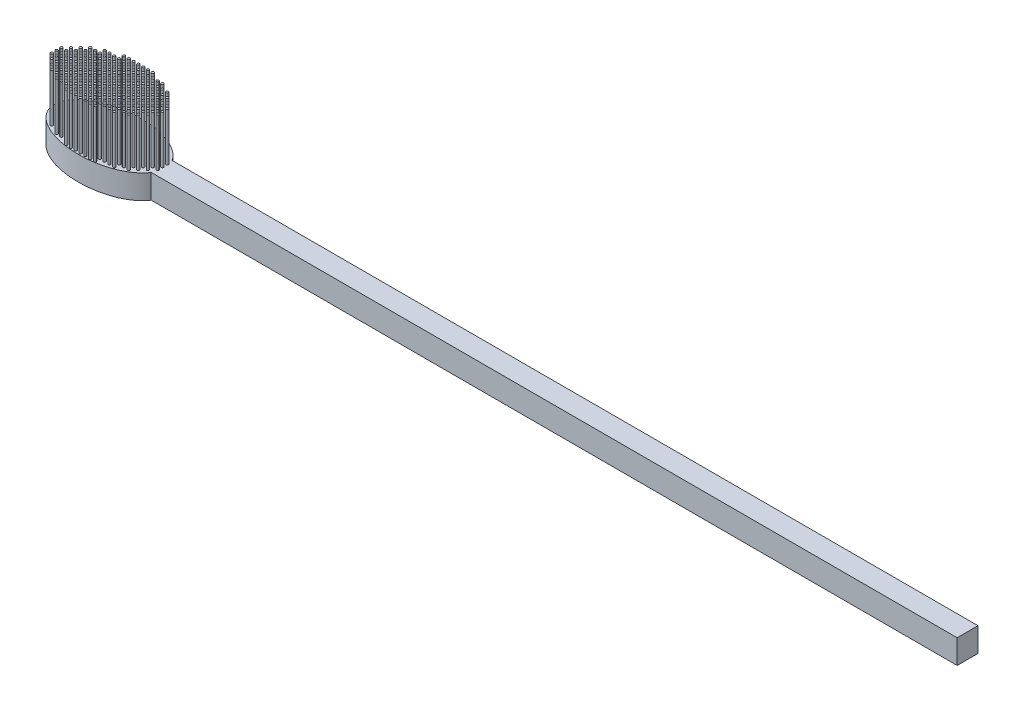
from build123d import *

# Parameters (mm, degrees)
BOSS_EXTRUDE1_DEPTH       = 5
SKETCH3_R                 = 0.25
BOSS_EXTRUDE2_DEPTH       = 10
LPATTERN1_COUNT           = 12
LPATTERN1_PITCH           = 1
LPATTERN1_COUNT_DIR2      = 7
LPATTERN1_PITCH_DIR2      = 1
MIRROR1_COPY_1_SKETCH_R   = 0.25
MIRROR1_COPY_1_DEPTH      = 10
MIRROR1_COPY_2_SKETCH_R   = 0.25
MIRROR1_COPY_2_DEPTH      = 10
MIRROR1_COPY_3_SKETCH_R   = 0.25
MIRROR1_COPY_3_DEPTH      = 10
MIRROR1_COPY_4_SKETCH_R   = 0.25
MIRROR1_COPY_4_DEPTH      = 10
MIRROR1_COPY_5_SKETCH_R   = 0.25
MIRROR1_COPY_5_DEPTH      = 10
MIRROR1_COPY_6_SKETCH_R   = 0.25
MIRROR1_COPY_6_DEPTH      = 10
MIRROR1_COPY_7_SKETCH_R   = 0.25
MIRROR1_COPY_7_DEPTH      = 10
MIRROR1_COPY_8_SKETCH_R   = 0.25
MIRROR1_COPY_8_DEPTH      = 10
MIRROR1_COPY_9_SKETCH_R   = 0.25
MIRROR1_COPY_9_DEPTH      = 10
MIRROR1_COPY_10_SKETCH_R  = 0.25
MIRROR1_COPY_10_DEPTH     = 10
MIRROR1_COPY_11_SKETCH_R  = 0.25
MIRROR1_COPY_11_DEPTH     = 10
MIRROR1_COPY_12_SKETCH_R  = 0.25
MIRROR1_COPY_12_DEPTH     = 10
MIRROR1_COPY_13_SKETCH_R  = 0.25
MIRROR1_COPY_13_DEPTH     = 10
MIRROR1_COPY_14_SKETCH_R  = 0.25
MIRROR1_COPY_14_DEPTH     = 10
MIRROR1_COPY_15_SKETCH_R  = 0.25
MIRROR1_COPY_15_DEPTH     = 10
MIRROR1_COPY_16_SKETCH_R  = 0.25
MIRROR1_COPY_16_DEPTH     = 10
MIRROR1_COPY_17_SKETCH_R  = 0.25
MIRROR1_COPY_17_DEPTH     = 10
MIRROR1_COPY_18_SKETCH_R  = 0.25
MIRROR1_COPY_18_DEPTH     = 10
MIRROR1_COPY_19_SKETCH_R  = 0.25
MIRROR1_COPY_19_DEPTH     = 10
MIRROR1_COPY_20_SKETCH_R  = 0.25
MIRROR1_COPY_20_DEPTH     = 10
MIRROR1_COPY_21_SKETCH_R  = 0.25
MIRROR1_COPY_21_DEPTH     = 10
MIRROR1_COPY_22_SKETCH_R  = 0.25
MIRROR1_COPY_22_DEPTH     = 10
MIRROR1_COPY_23_SKETCH_R  = 0.25
MIRROR1_COPY_23_DEPTH     = 10
MIRROR1_COPY_24_SKETCH_R  = 0.25
MIRROR1_COPY_24_DEPTH     = 10
MIRROR1_COPY_25_SKETCH_R  = 0.25
MIRROR1_COPY_25_DEPTH     = 10
MIRROR1_COPY_26_SKETCH_R  = 0.25
MIRROR1_COPY_26_DEPTH     = 10
MIRROR1_COPY_27_SKETCH_R  = 0.25
MIRROR1_COPY_27_DEPTH     = 10
MIRROR1_COPY_28_SKETCH_R  = 0.25
MIRROR1_COPY_28_DEPTH     = 10
MIRROR1_COPY_29_SKETCH_R  = 0.25
MIRROR1_COPY_29_DEPTH     = 10
MIRROR1_COPY_30_SKETCH_R  = 0.25
MIRROR1_COPY_30_DEPTH     = 10
MIRROR1_COPY_31_SKETCH_R  = 0.25
MIRROR1_COPY_31_DEPTH     = 10
MIRROR1_COPY_32_SKETCH_R  = 0.25
MIRROR1_COPY_32_DEPTH     = 10
MIRROR1_COPY_33_SKETCH_R  = 0.25
MIRROR1_COPY_33_DEPTH     = 10
MIRROR1_COPY_34_SKETCH_R  = 0.25
MIRROR1_COPY_34_DEPTH     = 10
MIRROR1_COPY_35_SKETCH_R  = 0.25
MIRROR1_COPY_35_DEPTH     = 10
MIRROR1_COPY_36_SKETCH_R  = 0.25
MIRROR1_COPY_36_DEPTH     = 10
MIRROR1_COPY_37_SKETCH_R  = 0.25
MIRROR1_COPY_37_DEPTH     = 10
MIRROR1_COPY_38_SKETCH_R  = 0.25
MIRROR1_COPY_38_DEPTH     = 10
MIRROR1_COPY_39_SKETCH_R  = 0.25
MIRROR1_COPY_39_DEPTH     = 10
MIRROR1_COPY_40_SKETCH_R  = 0.25
MIRROR1_COPY_40_DEPTH     = 10
MIRROR1_COPY_41_SKETCH_R  = 0.25
MIRROR1_COPY_41_DEPTH     = 10
MIRROR1_COPY_42_SKETCH_R  = 0.25
MIRROR1_COPY_42_DEPTH     = 10
MIRROR1_COPY_43_SKETCH_R  = 0.25
MIRROR1_COPY_43_DEPTH     = 10
MIRROR1_COPY_44_SKETCH_R  = 0.25
MIRROR1_COPY_44_DEPTH     = 10
MIRROR1_COPY_45_SKETCH_R  = 0.25
MIRROR1_COPY_45_DEPTH     = 10
MIRROR1_COPY_46_SKETCH_R  = 0.25
MIRROR1_COPY_46_DEPTH     = 10
MIRROR1_COPY_47_SKETCH_R  = 0.25
MIRROR1_COPY_47_DEPTH     = 10
MIRROR1_COPY_48_SKETCH_R  = 0.25
MIRROR1_COPY_48_DEPTH     = 10
MIRROR1_COPY_49_SKETCH_R  = 0.25
MIRROR1_COPY_49_DEPTH     = 10
MIRROR1_COPY_50_SKETCH_R  = 0.25
MIRROR1_COPY_50_DEPTH     = 10
MIRROR1_COPY_51_SKETCH_R  = 0.25
MIRROR1_COPY_51_DEPTH     = 10
MIRROR1_COPY_52_SKETCH_R  = 0.25
MIRROR1_COPY_52_DEPTH     = 10
MIRROR1_COPY_53_SKETCH_R  = 0.25
MIRROR1_COPY_53_DEPTH     = 10
MIRROR1_COPY_54_SKETCH_R  = 0.25
MIRROR1_COPY_54_DEPTH     = 10
MIRROR1_COPY_55_SKETCH_R  = 0.25
MIRROR1_COPY_55_DEPTH     = 10
MIRROR1_COPY_56_SKETCH_R  = 0.25
MIRROR1_COPY_56_DEPTH     = 10
MIRROR1_COPY_57_SKETCH_R  = 0.25
MIRROR1_COPY_57_DEPTH     = 10
MIRROR1_COPY_58_SKETCH_R  = 0.25
MIRROR1_COPY_58_DEPTH     = 10
MIRROR1_COPY_59_SKETCH_R  = 0.25
MIRROR1_COPY_59_DEPTH     = 10
MIRROR1_COPY_60_SKETCH_R  = 0.25
MIRROR1_COPY_60_DEPTH     = 10
MIRROR1_COPY_61_SKETCH_R  = 0.25
MIRROR1_COPY_61_DEPTH     = 10
MIRROR1_COPY_62_SKETCH_R  = 0.25
MIRROR1_COPY_62_DEPTH     = 10
MIRROR1_COPY_63_SKETCH_R  = 0.25
MIRROR1_COPY_63_DEPTH     = 10
MIRROR1_COPY_64_SKETCH_R  = 0.25
MIRROR1_COPY_64_DEPTH     = 10
MIRROR1_COPY_65_SKETCH_R  = 0.25
MIRROR1_COPY_65_DEPTH     = 10
MIRROR2_COPY_1_SKETCH_R   = 0.25
MIRROR2_COPY_1_DEPTH      = 10
MIRROR2_COPY_2_SKETCH_R   = 0.25
MIRROR2_COPY_2_DEPTH      = 10
MIRROR2_COPY_3_SKETCH_R   = 0.25
MIRROR2_COPY_3_DEPTH      = 10
MIRROR2_COPY_4_SKETCH_R   = 0.25
MIRROR2_COPY_4_DEPTH      = 10
MIRROR2_COPY_5_SKETCH_R   = 0.25
MIRROR2_COPY_5_DEPTH      = 10
MIRROR2_COPY_6_SKETCH_R   = 0.25
MIRROR2_COPY_6_DEPTH      = 10
MIRROR2_COPY_7_SKETCH_R   = 0.25
MIRROR2_COPY_7_DEPTH      = 10
MIRROR2_COPY_8_SKETCH_R   = 0.25
MIRROR2_COPY_8_DEPTH      = 10
MIRROR2_COPY_9_SKETCH_R   = 0.25
MIRROR2_COPY_9_DEPTH      = 10
MIRROR2_COPY_10_SKETCH_R  = 0.25
MIRROR2_COPY_10_DEPTH     = 10
MIRROR2_COPY_11_SKETCH_R  = 0.25
MIRROR2_COPY_11_DEPTH     = 10
MIRROR2_COPY_12_SKETCH_R  = 0.25
MIRROR2_COPY_12_DEPTH     = 10
MIRROR2_COPY_13_SKETCH_R  = 0.25
MIRROR2_COPY_13_DEPTH     = 10
MIRROR2_COPY_14_SKETCH_R  = 0.25
MIRROR2_COPY_14_DEPTH     = 10
MIRROR2_COPY_15_SKETCH_R  = 0.25
MIRROR2_COPY_15_DEPTH     = 10
MIRROR2_COPY_16_SKETCH_R  = 0.25
MIRROR2_COPY_16_DEPTH     = 10
MIRROR2_COPY_17_SKETCH_R  = 0.25
MIRROR2_COPY_17_DEPTH     = 10
MIRROR2_COPY_18_SKETCH_R  = 0.25
MIRROR2_COPY_18_DEPTH     = 10
MIRROR2_COPY_19_SKETCH_R  = 0.25
MIRROR2_COPY_19_DEPTH     = 10
MIRROR2_COPY_20_SKETCH_R  = 0.25
MIRROR2_COPY_20_DEPTH     = 10
MIRROR2_COPY_21_SKETCH_R  = 0.25
MIRROR2_COPY_21_DEPTH     = 10
MIRROR2_COPY_22_SKETCH_R  = 0.25
MIRROR2_COPY_22_DEPTH     = 10
MIRROR2_COPY_23_SKETCH_R  = 0.25
MIRROR2_COPY_23_DEPTH     = 10
MIRROR2_COPY_24_SKETCH_R  = 0.25
MIRROR2_COPY_24_DEPTH     = 10
MIRROR2_COPY_25_SKETCH_R  = 0.25
MIRROR2_COPY_25_DEPTH     = 10
MIRROR2_COPY_26_SKETCH_R  = 0.25
MIRROR2_COPY_26_DEPTH     = 10
MIRROR2_COPY_27_SKETCH_R  = 0.25
MIRROR2_COPY_27_DEPTH     = 10
MIRROR2_COPY_28_SKETCH_R  = 0.25
MIRROR2_COPY_28_DEPTH     = 10
MIRROR2_COPY_29_SKETCH_R  = 0.25
MIRROR2_COPY_29_DEPTH     = 10
MIRROR2_COPY_30_SKETCH_R  = 0.25
MIRROR2_COPY_30_DEPTH     = 10
MIRROR2_COPY_31_SKETCH_R  = 0.25
MIRROR2_COPY_31_DEPTH     = 10
MIRROR2_COPY_32_SKETCH_R  = 0.25
MIRROR2_COPY_32_DEPTH     = 10
MIRROR2_COPY_33_SKETCH_R  = 0.25
MIRROR2_COPY_33_DEPTH     = 10
MIRROR2_COPY_34_SKETCH_R  = 0.25
MIRROR2_COPY_34_DEPTH     = 10
MIRROR2_COPY_35_SKETCH_R  = 0.25
MIRROR2_COPY_35_DEPTH     = 10
MIRROR2_COPY_36_SKETCH_R  = 0.25
MIRROR2_COPY_36_DEPTH     = 10
MIRROR2_COPY_37_SKETCH_R  = 0.25
MIRROR2_COPY_37_DEPTH     = 10
MIRROR2_COPY_38_SKETCH_R  = 0.25
MIRROR2_COPY_38_DEPTH     = 10
MIRROR2_COPY_39_SKETCH_R  = 0.25
MIRROR2_COPY_39_DEPTH     = 10
MIRROR2_COPY_40_SKETCH_R  = 0.25
MIRROR2_COPY_40_DEPTH     = 10
MIRROR2_COPY_41_SKETCH_R  = 0.25
MIRROR2_COPY_41_DEPTH     = 10
MIRROR2_COPY_42_SKETCH_R  = 0.25
MIRROR2_COPY_42_DEPTH     = 10
MIRROR2_COPY_43_SKETCH_R  = 0.25
MIRROR2_COPY_43_DEPTH     = 10
MIRROR2_COPY_44_SKETCH_R  = 0.25
MIRROR2_COPY_44_DEPTH     = 10
MIRROR2_COPY_45_SKETCH_R  = 0.25
MIRROR2_COPY_45_DEPTH     = 10
MIRROR2_COPY_46_SKETCH_R  = 0.25
MIRROR2_COPY_46_DEPTH     = 10
MIRROR2_COPY_47_SKETCH_R  = 0.25
MIRROR2_COPY_47_DEPTH     = 10
MIRROR2_COPY_48_SKETCH_R  = 0.25
MIRROR2_COPY_48_DEPTH     = 10
MIRROR2_COPY_49_SKETCH_R  = 0.25
MIRROR2_COPY_49_DEPTH     = 10
MIRROR2_COPY_50_SKETCH_R  = 0.25
MIRROR2_COPY_50_DEPTH     = 10
MIRROR2_COPY_51_SKETCH_R  = 0.25
MIRROR2_COPY_51_DEPTH     = 10
MIRROR2_COPY_52_SKETCH_R  = 0.25
MIRROR2_COPY_52_DEPTH     = 10
MIRROR2_COPY_53_SKETCH_R  = 0.25
MIRROR2_COPY_53_DEPTH     = 10
MIRROR2_COPY_54_SKETCH_R  = 0.25
MIRROR2_COPY_54_DEPTH     = 10
MIRROR2_COPY_55_SKETCH_R  = 0.25
MIRROR2_COPY_55_DEPTH     = 10
MIRROR2_COPY_56_SKETCH_R  = 0.25
MIRROR2_COPY_56_DEPTH     = 10
MIRROR2_COPY_57_SKETCH_R  = 0.25
MIRROR2_COPY_57_DEPTH     = 10
MIRROR2_COPY_58_SKETCH_R  = 0.25
MIRROR2_COPY_58_DEPTH     = 10
MIRROR2_COPY_59_SKETCH_R  = 0.25
MIRROR2_COPY_59_DEPTH     = 10
MIRROR2_COPY_60_SKETCH_R  = 0.25
MIRROR2_COPY_60_DEPTH     = 10
MIRROR2_COPY_61_SKETCH_R  = 0.25
MIRROR2_COPY_61_DEPTH     = 10
MIRROR2_COPY_62_SKETCH_R  = 0.25
MIRROR2_COPY_62_DEPTH     = 10
MIRROR2_COPY_63_SKETCH_R  = 0.25
MIRROR2_COPY_63_DEPTH     = 10
MIRROR2_COPY_64_SKETCH_R  = 0.25
MIRROR2_COPY_64_DEPTH     = 10
MIRROR2_COPY_65_SKETCH_R  = 0.25
MIRROR2_COPY_65_DEPTH     = 10
MIRROR2_COPY_66_SKETCH_R  = 0.25
MIRROR2_COPY_66_DEPTH     = 10
MIRROR2_COPY_67_SKETCH_R  = 0.25
MIRROR2_COPY_67_DEPTH     = 10
MIRROR2_COPY_68_SKETCH_R  = 0.25
MIRROR2_COPY_68_DEPTH     = 10
MIRROR2_COPY_69_SKETCH_R  = 0.25
MIRROR2_COPY_69_DEPTH     = 10
MIRROR2_COPY_70_SKETCH_R  = 0.25
MIRROR2_COPY_70_DEPTH     = 10
MIRROR2_COPY_71_SKETCH_R  = 0.25
MIRROR2_COPY_71_DEPTH     = 10
MIRROR2_COPY_72_SKETCH_R  = 0.25
MIRROR2_COPY_72_DEPTH     = 10
MIRROR2_COPY_73_SKETCH_R  = 0.25
MIRROR2_COPY_73_DEPTH     = 10
MIRROR2_COPY_74_SKETCH_R  = 0.25
MIRROR2_COPY_74_DEPTH     = 10
MIRROR2_COPY_75_SKETCH_R  = 0.25
MIRROR2_COPY_75_DEPTH     = 10
MIRROR2_COPY_76_SKETCH_R  = 0.25
MIRROR2_COPY_76_DEPTH     = 10
MIRROR2_COPY_77_SKETCH_R  = 0.25
MIRROR2_COPY_77_DEPTH     = 10
MIRROR2_COPY_78_SKETCH_R  = 0.25
MIRROR2_COPY_78_DEPTH     = 10
MIRROR2_COPY_79_SKETCH_R  = 0.25
MIRROR2_COPY_79_DEPTH     = 10
MIRROR2_COPY_80_SKETCH_R  = 0.25
MIRROR2_COPY_80_DEPTH     = 10
MIRROR2_COPY_81_SKETCH_R  = 0.25
MIRROR2_COPY_81_DEPTH     = 10
MIRROR2_COPY_82_SKETCH_R  = 0.25
MIRROR2_COPY_82_DEPTH     = 10
MIRROR2_COPY_83_SKETCH_R  = 0.25
MIRROR2_COPY_83_DEPTH     = 10
MIRROR2_COPY_84_SKETCH_R  = 0.25
MIRROR2_COPY_84_DEPTH     = 10
MIRROR2_COPY_85_SKETCH_R  = 0.25
MIRROR2_COPY_85_DEPTH     = 10
MIRROR2_COPY_86_SKETCH_R  = 0.25
MIRROR2_COPY_86_DEPTH     = 10
MIRROR2_COPY_87_SKETCH_R  = 0.25
MIRROR2_COPY_87_DEPTH     = 10
MIRROR2_COPY_88_SKETCH_R  = 0.25
MIRROR2_COPY_88_DEPTH     = 10
MIRROR2_COPY_89_SKETCH_R  = 0.25
MIRROR2_COPY_89_DEPTH     = 10
MIRROR2_COPY_90_SKETCH_R  = 0.25
MIRROR2_COPY_90_DEPTH     = 10
MIRROR2_COPY_91_SKETCH_R  = 0.25
MIRROR2_COPY_91_DEPTH     = 10
MIRROR2_COPY_92_SKETCH_R  = 0.25
MIRROR2_COPY_92_DEPTH     = 10
MIRROR2_COPY_93_SKETCH_R  = 0.25
MIRROR2_COPY_93_DEPTH     = 10
MIRROR2_COPY_94_SKETCH_R  = 0.25
MIRROR2_COPY_94_DEPTH     = 10
MIRROR2_COPY_95_SKETCH_R  = 0.25
MIRROR2_COPY_95_DEPTH     = 10
MIRROR2_COPY_96_SKETCH_R  = 0.25
MIRROR2_COPY_96_DEPTH     = 10
MIRROR2_COPY_97_SKETCH_R  = 0.25
MIRROR2_COPY_97_DEPTH     = 10
MIRROR2_COPY_98_SKETCH_R  = 0.25
MIRROR2_COPY_98_DEPTH     = 10
MIRROR2_COPY_99_SKETCH_R  = 0.25
MIRROR2_COPY_99_DEPTH     = 10
MIRROR2_COPY_100_SKETCH_R = 0.25
MIRROR2_COPY_100_DEPTH    = 10
MIRROR2_COPY_101_SKETCH_R = 0.25
MIRROR2_COPY_101_DEPTH    = 10
MIRROR2_COPY_102_SKETCH_R = 0.25
MIRROR2_COPY_102_DEPTH    = 10
MIRROR2_COPY_103_SKETCH_R = 0.25
MIRROR2_COPY_103_DEPTH    = 10
MIRROR2_COPY_104_SKETCH_R = 0.25
MIRROR2_COPY_104_DEPTH    = 10
MIRROR2_COPY_105_SKETCH_R = 0.25
MIRROR2_COPY_105_DEPTH    = 10
MIRROR2_COPY_106_SKETCH_R = 0.25
MIRROR2_COPY_106_DEPTH    = 10
MIRROR2_COPY_107_SKETCH_R = 0.25
MIRROR2_COPY_107_DEPTH    = 10
MIRROR2_COPY_108_SKETCH_R = 0.25
MIRROR2_COPY_108_DEPTH    = 10
MIRROR2_COPY_109_SKETCH_R = 0.25
MIRROR2_COPY_109_DEPTH    = 10
MIRROR2_COPY_110_SKETCH_R = 0.25
MIRROR2_COPY_110_DEPTH    = 10
MIRROR2_COPY_111_SKETCH_R = 0.25
MIRROR2_COPY_111_DEPTH    = 10
MIRROR2_COPY_112_SKETCH_R = 0.25
MIRROR2_COPY_112_DEPTH    = 10
MIRROR2_COPY_113_SKETCH_R = 0.25
MIRROR2_COPY_113_DEPTH    = 10
MIRROR2_COPY_114_SKETCH_R = 0.25
MIRROR2_COPY_114_DEPTH    = 10
MIRROR2_COPY_115_SKETCH_R = 0.25
MIRROR2_COPY_115_DEPTH    = 10
MIRROR2_COPY_116_SKETCH_R = 0.25
MIRROR2_COPY_116_DEPTH    = 10
MIRROR2_COPY_117_SKETCH_R = 0.25
MIRROR2_COPY_117_DEPTH    = 10
MIRROR2_COPY_118_SKETCH_R = 0.25
MIRROR2_COPY_118_DEPTH    = 10
MIRROR2_COPY_119_SKETCH_R = 0.25
MIRROR2_COPY_119_DEPTH    = 10
MIRROR2_COPY_120_SKETCH_R = 0.25
MIRROR2_COPY_120_DEPTH    = 10
MIRROR2_COPY_121_SKETCH_R = 0.25
MIRROR2_COPY_121_DEPTH    = 10
MIRROR2_COPY_122_SKETCH_R = 0.25
MIRROR2_COPY_122_DEPTH    = 10
MIRROR2_COPY_123_SKETCH_R = 0.25
MIRROR2_COPY_123_DEPTH    = 10
MIRROR2_COPY_124_SKETCH_R = 0.25
MIRROR2_COPY_124_DEPTH    = 10
MIRROR2_COPY_125_SKETCH_R = 0.25
MIRROR2_COPY_125_DEPTH    = 10
MIRROR2_COPY_126_SKETCH_R = 0.25
MIRROR2_COPY_126_DEPTH    = 10
MIRROR2_COPY_127_SKETCH_R = 0.25
MIRROR2_COPY_127_DEPTH    = 10
MIRROR2_COPY_128_SKETCH_R = 0.25
MIRROR2_COPY_128_DEPTH    = 10
MIRROR2_COPY_129_SKETCH_R = 0.25
MIRROR2_COPY_129_DEPTH    = 10
MIRROR2_COPY_130_SKETCH_R = 0.25
MIRROR2_COPY_130_DEPTH    = 10
MIRROR2_COPY_131_SKETCH_R = 0.25
MIRROR2_COPY_131_DEPTH    = 10


with BuildPart() as part:
    # Sketch1 → Boss-Extrude1 (new body)
    with BuildSketch(Plane(origin=(0, 0, 0), x_dir=(1, 0, 0), z_dir=(0, 1, 0))):
        with BuildLine():
            Line((10.842303978, -2.166666667), (178.5, -2.166666667))
            Line((178.5, -2.166666667), (178.5, 2.166666667))
            Line((178.5, 2.166666667), (10.842303978, 2.166666667))
            add(Edge.make_bspline(
                [(10.842303978, 2.166666667), (5.660036883, 10.451433739), (-6.838914155, 5.225716869), (-19.337865193, 0), (-6.838914155, -5.225716869), (5.660036883, -10.451433739), (10.842303978, -2.166666667)],
                knots=[0.339836909, 0.339836909, 0.339836909, 2.207674072, 2.207674072, 4.075511235, 4.075511235, 5.943348398, 5.943348398, 5.943348398], degree=2, weights=[1, 0.594688187, 1, 0.594688187, 1, 0.594688187, 1]))
        make_face()
    extrude(amount=-BOSS_EXTRUDE1_DEPTH)

    # Sketch3 → Boss-Extrude2 (add)
    with BuildSketch(Plane(origin=(0, 0, 0), x_dir=(1, 0, 0), z_dir=(0, 1, 0))):
        Circle(SKETCH3_R)
    boss_extrude2 = extrude(amount=BOSS_EXTRUDE2_DEPTH)

    # LPattern1: Boss-Extrude2 12 × 7, 19 skipped
    with Locations(*[(i * LPATTERN1_PITCH, 0, j * LPATTERN1_PITCH_DIR2) for i in range(LPATTERN1_COUNT) for j in range(LPATTERN1_COUNT_DIR2) if (i, j) not in ((0, 0), (4, 6), (5, 6), (6, 6), (7, 5), (7, 6), (8, 5), (8, 6), (9, 4), (9, 5), (9, 6), (10, 3), (10, 4), (10, 5), (10, 6), (11, 2), (11, 3), (11, 4), (11, 5), (11, 6))]):
        add(boss_extrude2)

    # Mirror1 copy 1 sketch → Mirror1 copy 1 (add)
    with BuildSketch(Plane(origin=(0, 0, -1), x_dir=(1, 0, 0), z_dir=(0, 1, 0))):
        Circle(MIRROR1_COPY_1_SKETCH_R)
    extrude(amount=MIRROR1_COPY_1_DEPTH)

    # Mirror1 copy 2 sketch → Mirror1 copy 2 (add)
    with BuildSketch(Plane(origin=(0, 0, -2), x_dir=(1, 0, 0), z_dir=(0, 1, 0))):
        Circle(MIRROR1_COPY_2_SKETCH_R)
    extrude(amount=MIRROR1_COPY_2_DEPTH)

    # Mirror1 copy 3 sketch → Mirror1 copy 3 (add)
    with BuildSketch(Plane(origin=(0, 0, -3), x_dir=(1, 0, 0), z_dir=(0, 1, 0))):
        Circle(MIRROR1_COPY_3_SKETCH_R)
    extrude(amount=MIRROR1_COPY_3_DEPTH)

    # Mirror1 copy 4 sketch → Mirror1 copy 4 (add)
    with BuildSketch(Plane(origin=(0, 0, -4), x_dir=(1, 0, 0), z_dir=(0, 1, 0))):
        Circle(MIRROR1_COPY_4_SKETCH_R)
    extrude(amount=MIRROR1_COPY_4_DEPTH)

    # Mirror1 copy 5 sketch → Mirror1 copy 5 (add)
    with BuildSketch(Plane(origin=(0, 0, -5), x_dir=(1, 0, 0), z_dir=(0, 1, 0))):
        Circle(MIRROR1_COPY_5_SKETCH_R)
    extrude(amount=MIRROR1_COPY_5_DEPTH)

    # Mirror1 copy 6 sketch → Mirror1 copy 6 (add)
    with BuildSketch(Plane(origin=(0, 0, -6), x_dir=(1, 0, 0), z_dir=(0, 1, 0))):
        Circle(MIRROR1_COPY_6_SKETCH_R)
    extrude(amount=MIRROR1_COPY_6_DEPTH)

    # Mirror1 copy 7 sketch → Mirror1 copy 7 (add)
    with BuildSketch(Plane(origin=(1, 0, 0), x_dir=(1, 0, 0), z_dir=(0, 1, 0))):
        Circle(MIRROR1_COPY_7_SKETCH_R)
    extrude(amount=MIRROR1_COPY_7_DEPTH)

    # Mirror1 copy 8 sketch → Mirror1 copy 8 (add)
    with BuildSketch(Plane(origin=(1, 0, -1), x_dir=(1, 0, 0), z_dir=(0, 1, 0))):
        Circle(MIRROR1_COPY_8_SKETCH_R)
    extrude(amount=MIRROR1_COPY_8_DEPTH)

    # Mirror1 copy 9 sketch → Mirror1 copy 9 (add)
    with BuildSketch(Plane(origin=(1, 0, -2), x_dir=(1, 0, 0), z_dir=(0, 1, 0))):
        Circle(MIRROR1_COPY_9_SKETCH_R)
    extrude(amount=MIRROR1_COPY_9_DEPTH)

    # Mirror1 copy 10 sketch → Mirror1 copy 10 (add)
    with BuildSketch(Plane(origin=(1, 0, -3), x_dir=(1, 0, 0), z_dir=(0, 1, 0))):
        Circle(MIRROR1_COPY_10_SKETCH_R)
    extrude(amount=MIRROR1_COPY_10_DEPTH)

    # Mirror1 copy 11 sketch → Mirror1 copy 11 (add)
    with BuildSketch(Plane(origin=(1, 0, -4), x_dir=(1, 0, 0), z_dir=(0, 1, 0))):
        Circle(MIRROR1_COPY_11_SKETCH_R)
    extrude(amount=MIRROR1_COPY_11_DEPTH)

    # Mirror1 copy 12 sketch → Mirror1 copy 12 (add)
    with BuildSketch(Plane(origin=(1, 0, -5), x_dir=(1, 0, 0), z_dir=(0, 1, 0))):
        Circle(MIRROR1_COPY_12_SKETCH_R)
    extrude(amount=MIRROR1_COPY_12_DEPTH)

    # Mirror1 copy 13 sketch → Mirror1 copy 13 (add)
    with BuildSketch(Plane(origin=(1, 0, -6), x_dir=(1, 0, 0), z_dir=(0, 1, 0))):
        Circle(MIRROR1_COPY_13_SKETCH_R)
    extrude(amount=MIRROR1_COPY_13_DEPTH)

    # Mirror1 copy 14 sketch → Mirror1 copy 14 (add)
    with BuildSketch(Plane(origin=(2, 0, 0), x_dir=(1, 0, 0), z_dir=(0, 1, 0))):
        Circle(MIRROR1_COPY_14_SKETCH_R)
    extrude(amount=MIRROR1_COPY_14_DEPTH)

    # Mirror1 copy 15 sketch → Mirror1 copy 15 (add)
    with BuildSketch(Plane(origin=(2, 0, -1), x_dir=(1, 0, 0), z_dir=(0, 1, 0))):
        Circle(MIRROR1_COPY_15_SKETCH_R)
    extrude(amount=MIRROR1_COPY_15_DEPTH)

    # Mirror1 copy 16 sketch → Mirror1 copy 16 (add)
    with BuildSketch(Plane(origin=(2, 0, -2), x_dir=(1, 0, 0), z_dir=(0, 1, 0))):
        Circle(MIRROR1_COPY_16_SKETCH_R)
    extrude(amount=MIRROR1_COPY_16_DEPTH)

    # Mirror1 copy 17 sketch → Mirror1 copy 17 (add)
    with BuildSketch(Plane(origin=(2, 0, -3), x_dir=(1, 0, 0), z_dir=(0, 1, 0))):
        Circle(MIRROR1_COPY_17_SKETCH_R)
    extrude(amount=MIRROR1_COPY_17_DEPTH)

    # Mirror1 copy 18 sketch → Mirror1 copy 18 (add)
    with BuildSketch(Plane(origin=(2, 0, -4), x_dir=(1, 0, 0), z_dir=(0, 1, 0))):
        Circle(MIRROR1_COPY_18_SKETCH_R)
    extrude(amount=MIRROR1_COPY_18_DEPTH)

    # Mirror1 copy 19 sketch → Mirror1 copy 19 (add)
    with BuildSketch(Plane(origin=(2, 0, -5), x_dir=(1, 0, 0), z_dir=(0, 1, 0))):
        Circle(MIRROR1_COPY_19_SKETCH_R)
    extrude(amount=MIRROR1_COPY_19_DEPTH)

    # Mirror1 copy 20 sketch → Mirror1 copy 20 (add)
    with BuildSketch(Plane(origin=(2, 0, -6), x_dir=(1, 0, 0), z_dir=(0, 1, 0))):
        Circle(MIRROR1_COPY_20_SKETCH_R)
    extrude(amount=MIRROR1_COPY_20_DEPTH)

    # Mirror1 copy 21 sketch → Mirror1 copy 21 (add)
    with BuildSketch(Plane(origin=(3, 0, 0), x_dir=(1, 0, 0), z_dir=(0, 1, 0))):
        Circle(MIRROR1_COPY_21_SKETCH_R)
    extrude(amount=MIRROR1_COPY_21_DEPTH)

    # Mirror1 copy 22 sketch → Mirror1 copy 22 (add)
    with BuildSketch(Plane(origin=(3, 0, -1), x_dir=(1, 0, 0), z_dir=(0, 1, 0))):
        Circle(MIRROR1_COPY_22_SKETCH_R)
    extrude(amount=MIRROR1_COPY_22_DEPTH)

    # Mirror1 copy 23 sketch → Mirror1 copy 23 (add)
    with BuildSketch(Plane(origin=(3, 0, -2), x_dir=(1, 0, 0), z_dir=(0, 1, 0))):
        Circle(MIRROR1_COPY_23_SKETCH_R)
    extrude(amount=MIRROR1_COPY_23_DEPTH)

    # Mirror1 copy 24 sketch → Mirror1 copy 24 (add)
    with BuildSketch(Plane(origin=(3, 0, -3), x_dir=(1, 0, 0), z_dir=(0, 1, 0))):
        Circle(MIRROR1_COPY_24_SKETCH_R)
    extrude(amount=MIRROR1_COPY_24_DEPTH)

    # Mirror1 copy 25 sketch → Mirror1 copy 25 (add)
    with BuildSketch(Plane(origin=(3, 0, -4), x_dir=(1, 0, 0), z_dir=(0, 1, 0))):
        Circle(MIRROR1_COPY_25_SKETCH_R)
    extrude(amount=MIRROR1_COPY_25_DEPTH)

    # Mirror1 copy 26 sketch → Mirror1 copy 26 (add)
    with BuildSketch(Plane(origin=(3, 0, -5), x_dir=(1, 0, 0), z_dir=(0, 1, 0))):
        Circle(MIRROR1_COPY_26_SKETCH_R)
    extrude(amount=MIRROR1_COPY_26_DEPTH)

    # Mirror1 copy 27 sketch → Mirror1 copy 27 (add)
    with BuildSketch(Plane(origin=(3, 0, -6), x_dir=(1, 0, 0), z_dir=(0, 1, 0))):
        Circle(MIRROR1_COPY_27_SKETCH_R)
    extrude(amount=MIRROR1_COPY_27_DEPTH)

    # Mirror1 copy 28 sketch → Mirror1 copy 28 (add)
    with BuildSketch(Plane(origin=(4, 0, 0), x_dir=(1, 0, 0), z_dir=(0, 1, 0))):
        Circle(MIRROR1_COPY_28_SKETCH_R)
    extrude(amount=MIRROR1_COPY_28_DEPTH)

    # Mirror1 copy 29 sketch → Mirror1 copy 29 (add)
    with BuildSketch(Plane(origin=(4, 0, -1), x_dir=(1, 0, 0), z_dir=(0, 1, 0))):
        Circle(MIRROR1_COPY_29_SKETCH_R)
    extrude(amount=MIRROR1_COPY_29_DEPTH)

    # Mirror1 copy 30 sketch → Mirror1 copy 30 (add)
    with BuildSketch(Plane(origin=(4, 0, -2), x_dir=(1, 0, 0), z_dir=(0, 1, 0))):
        Circle(MIRROR1_COPY_30_SKETCH_R)
    extrude(amount=MIRROR1_COPY_30_DEPTH)

    # Mirror1 copy 31 sketch → Mirror1 copy 31 (add)
    with BuildSketch(Plane(origin=(4, 0, -3), x_dir=(1, 0, 0), z_dir=(0, 1, 0))):
        Circle(MIRROR1_COPY_31_SKETCH_R)
    extrude(amount=MIRROR1_COPY_31_DEPTH)

    # Mirror1 copy 32 sketch → Mirror1 copy 32 (add)
    with BuildSketch(Plane(origin=(4, 0, -4), x_dir=(1, 0, 0), z_dir=(0, 1, 0))):
        Circle(MIRROR1_COPY_32_SKETCH_R)
    extrude(amount=MIRROR1_COPY_32_DEPTH)

    # Mirror1 copy 33 sketch → Mirror1 copy 33 (add)
    with BuildSketch(Plane(origin=(4, 0, -5), x_dir=(1, 0, 0), z_dir=(0, 1, 0))):
        Circle(MIRROR1_COPY_33_SKETCH_R)
    extrude(amount=MIRROR1_COPY_33_DEPTH)

    # Mirror1 copy 34 sketch → Mirror1 copy 34 (add)
    with BuildSketch(Plane(origin=(5, 0, 0), x_dir=(1, 0, 0), z_dir=(0, 1, 0))):
        Circle(MIRROR1_COPY_34_SKETCH_R)
    extrude(amount=MIRROR1_COPY_34_DEPTH)

    # Mirror1 copy 35 sketch → Mirror1 copy 35 (add)
    with BuildSketch(Plane(origin=(5, 0, -1), x_dir=(1, 0, 0), z_dir=(0, 1, 0))):
        Circle(MIRROR1_COPY_35_SKETCH_R)
    extrude(amount=MIRROR1_COPY_35_DEPTH)

    # Mirror1 copy 36 sketch → Mirror1 copy 36 (add)
    with BuildSketch(Plane(origin=(5, 0, -2), x_dir=(1, 0, 0), z_dir=(0, 1, 0))):
        Circle(MIRROR1_COPY_36_SKETCH_R)
    extrude(amount=MIRROR1_COPY_36_DEPTH)

    # Mirror1 copy 37 sketch → Mirror1 copy 37 (add)
    with BuildSketch(Plane(origin=(5, 0, -3), x_dir=(1, 0, 0), z_dir=(0, 1, 0))):
        Circle(MIRROR1_COPY_37_SKETCH_R)
    extrude(amount=MIRROR1_COPY_37_DEPTH)

    # Mirror1 copy 38 sketch → Mirror1 copy 38 (add)
    with BuildSketch(Plane(origin=(5, 0, -4), x_dir=(1, 0, 0), z_dir=(0, 1, 0))):
        Circle(MIRROR1_COPY_38_SKETCH_R)
    extrude(amount=MIRROR1_COPY_38_DEPTH)

    # Mirror1 copy 39 sketch → Mirror1 copy 39 (add)
    with BuildSketch(Plane(origin=(5, 0, -5), x_dir=(1, 0, 0), z_dir=(0, 1, 0))):
        Circle(MIRROR1_COPY_39_SKETCH_R)
    extrude(amount=MIRROR1_COPY_39_DEPTH)

    # Mirror1 copy 40 sketch → Mirror1 copy 40 (add)
    with BuildSketch(Plane(origin=(6, 0, 0), x_dir=(1, 0, 0), z_dir=(0, 1, 0))):
        Circle(MIRROR1_COPY_40_SKETCH_R)
    extrude(amount=MIRROR1_COPY_40_DEPTH)

    # Mirror1 copy 41 sketch → Mirror1 copy 41 (add)
    with BuildSketch(Plane(origin=(6, 0, -1), x_dir=(1, 0, 0), z_dir=(0, 1, 0))):
        Circle(MIRROR1_COPY_41_SKETCH_R)
    extrude(amount=MIRROR1_COPY_41_DEPTH)

    # Mirror1 copy 42 sketch → Mirror1 copy 42 (add)
    with BuildSketch(Plane(origin=(6, 0, -2), x_dir=(1, 0, 0), z_dir=(0, 1, 0))):
        Circle(MIRROR1_COPY_42_SKETCH_R)
    extrude(amount=MIRROR1_COPY_42_DEPTH)

    # Mirror1 copy 43 sketch → Mirror1 copy 43 (add)
    with BuildSketch(Plane(origin=(6, 0, -3), x_dir=(1, 0, 0), z_dir=(0, 1, 0))):
        Circle(MIRROR1_COPY_43_SKETCH_R)
    extrude(amount=MIRROR1_COPY_43_DEPTH)

    # Mirror1 copy 44 sketch → Mirror1 copy 44 (add)
    with BuildSketch(Plane(origin=(6, 0, -4), x_dir=(1, 0, 0), z_dir=(0, 1, 0))):
        Circle(MIRROR1_COPY_44_SKETCH_R)
    extrude(amount=MIRROR1_COPY_44_DEPTH)

    # Mirror1 copy 45 sketch → Mirror1 copy 45 (add)
    with BuildSketch(Plane(origin=(6, 0, -5), x_dir=(1, 0, 0), z_dir=(0, 1, 0))):
        Circle(MIRROR1_COPY_45_SKETCH_R)
    extrude(amount=MIRROR1_COPY_45_DEPTH)

    # Mirror1 copy 46 sketch → Mirror1 copy 46 (add)
    with BuildSketch(Plane(origin=(7, 0, 0), x_dir=(1, 0, 0), z_dir=(0, 1, 0))):
        Circle(MIRROR1_COPY_46_SKETCH_R)
    extrude(amount=MIRROR1_COPY_46_DEPTH)

    # Mirror1 copy 47 sketch → Mirror1 copy 47 (add)
    with BuildSketch(Plane(origin=(7, 0, -1), x_dir=(1, 0, 0), z_dir=(0, 1, 0))):
        Circle(MIRROR1_COPY_47_SKETCH_R)
    extrude(amount=MIRROR1_COPY_47_DEPTH)

    # Mirror1 copy 48 sketch → Mirror1 copy 48 (add)
    with BuildSketch(Plane(origin=(7, 0, -2), x_dir=(1, 0, 0), z_dir=(0, 1, 0))):
        Circle(MIRROR1_COPY_48_SKETCH_R)
    extrude(amount=MIRROR1_COPY_48_DEPTH)

    # Mirror1 copy 49 sketch → Mirror1 copy 49 (add)
    with BuildSketch(Plane(origin=(7, 0, -3), x_dir=(1, 0, 0), z_dir=(0, 1, 0))):
        Circle(MIRROR1_COPY_49_SKETCH_R)
    extrude(amount=MIRROR1_COPY_49_DEPTH)

    # Mirror1 copy 50 sketch → Mirror1 copy 50 (add)
    with BuildSketch(Plane(origin=(7, 0, -4), x_dir=(1, 0, 0), z_dir=(0, 1, 0))):
        Circle(MIRROR1_COPY_50_SKETCH_R)
    extrude(amount=MIRROR1_COPY_50_DEPTH)

    # Mirror1 copy 51 sketch → Mirror1 copy 51 (add)
    with BuildSketch(Plane(origin=(8, 0, 0), x_dir=(1, 0, 0), z_dir=(0, 1, 0))):
        Circle(MIRROR1_COPY_51_SKETCH_R)
    extrude(amount=MIRROR1_COPY_51_DEPTH)

    # Mirror1 copy 52 sketch → Mirror1 copy 52 (add)
    with BuildSketch(Plane(origin=(8, 0, -1), x_dir=(1, 0, 0), z_dir=(0, 1, 0))):
        Circle(MIRROR1_COPY_52_SKETCH_R)
    extrude(amount=MIRROR1_COPY_52_DEPTH)

    # Mirror1 copy 53 sketch → Mirror1 copy 53 (add)
    with BuildSketch(Plane(origin=(8, 0, -2), x_dir=(1, 0, 0), z_dir=(0, 1, 0))):
        Circle(MIRROR1_COPY_53_SKETCH_R)
    extrude(amount=MIRROR1_COPY_53_DEPTH)

    # Mirror1 copy 54 sketch → Mirror1 copy 54 (add)
    with BuildSketch(Plane(origin=(8, 0, -3), x_dir=(1, 0, 0), z_dir=(0, 1, 0))):
        Circle(MIRROR1_COPY_54_SKETCH_R)
    extrude(amount=MIRROR1_COPY_54_DEPTH)

    # Mirror1 copy 55 sketch → Mirror1 copy 55 (add)
    with BuildSketch(Plane(origin=(8, 0, -4), x_dir=(1, 0, 0), z_dir=(0, 1, 0))):
        Circle(MIRROR1_COPY_55_SKETCH_R)
    extrude(amount=MIRROR1_COPY_55_DEPTH)

    # Mirror1 copy 56 sketch → Mirror1 copy 56 (add)
    with BuildSketch(Plane(origin=(9, 0, 0), x_dir=(1, 0, 0), z_dir=(0, 1, 0))):
        Circle(MIRROR1_COPY_56_SKETCH_R)
    extrude(amount=MIRROR1_COPY_56_DEPTH)

    # Mirror1 copy 57 sketch → Mirror1 copy 57 (add)
    with BuildSketch(Plane(origin=(9, 0, -1), x_dir=(1, 0, 0), z_dir=(0, 1, 0))):
        Circle(MIRROR1_COPY_57_SKETCH_R)
    extrude(amount=MIRROR1_COPY_57_DEPTH)

    # Mirror1 copy 58 sketch → Mirror1 copy 58 (add)
    with BuildSketch(Plane(origin=(9, 0, -2), x_dir=(1, 0, 0), z_dir=(0, 1, 0))):
        Circle(MIRROR1_COPY_58_SKETCH_R)
    extrude(amount=MIRROR1_COPY_58_DEPTH)

    # Mirror1 copy 59 sketch → Mirror1 copy 59 (add)
    with BuildSketch(Plane(origin=(9, 0, -3), x_dir=(1, 0, 0), z_dir=(0, 1, 0))):
        Circle(MIRROR1_COPY_59_SKETCH_R)
    extrude(amount=MIRROR1_COPY_59_DEPTH)

    # Mirror1 copy 60 sketch → Mirror1 copy 60 (add)
    with BuildSketch(Plane(origin=(10, 0, 0), x_dir=(1, 0, 0), z_dir=(0, 1, 0))):
        Circle(MIRROR1_COPY_60_SKETCH_R)
    extrude(amount=MIRROR1_COPY_60_DEPTH)

    # Mirror1 copy 61 sketch → Mirror1 copy 61 (add)
    with BuildSketch(Plane(origin=(10, 0, -1), x_dir=(1, 0, 0), z_dir=(0, 1, 0))):
        Circle(MIRROR1_COPY_61_SKETCH_R)
    extrude(amount=MIRROR1_COPY_61_DEPTH)

    # Mirror1 copy 62 sketch → Mirror1 copy 62 (add)
    with BuildSketch(Plane(origin=(10, 0, -2), x_dir=(1, 0, 0), z_dir=(0, 1, 0))):
        Circle(MIRROR1_COPY_62_SKETCH_R)
    extrude(amount=MIRROR1_COPY_62_DEPTH)

    # Mirror1 copy 63 sketch → Mirror1 copy 63 (add)
    with BuildSketch(Plane(origin=(11, 0, 0), x_dir=(1, 0, 0), z_dir=(0, 1, 0))):
        Circle(MIRROR1_COPY_63_SKETCH_R)
    extrude(amount=MIRROR1_COPY_63_DEPTH)

    # Mirror1 copy 64 sketch → Mirror1 copy 64 (add)
    with BuildSketch(Plane(origin=(11, 0, -1), x_dir=(1, 0, 0), z_dir=(0, 1, 0))):
        Circle(MIRROR1_COPY_64_SKETCH_R)
    extrude(amount=MIRROR1_COPY_64_DEPTH)

    # Mirror1 copy 65 sketch → Mirror1 copy 65 (add)
    with BuildSketch(Plane(origin=(0, 0, 0), x_dir=(1, 0, 0), z_dir=(0, 1, 0))):
        Circle(MIRROR1_COPY_65_SKETCH_R)
    extrude(amount=MIRROR1_COPY_65_DEPTH)

    # Mirror2 copy 1 sketch → Mirror2 copy 1 (add)
    with BuildSketch(Plane(origin=(0, 0, 1), x_dir=(-1, 0, 0), z_dir=(0, 1, 0))):
        Circle(MIRROR2_COPY_1_SKETCH_R)
    extrude(amount=MIRROR2_COPY_1_DEPTH)

    # Mirror2 copy 2 sketch → Mirror2 copy 2 (add)
    with BuildSketch(Plane(origin=(0, 0, 2), x_dir=(-1, 0, 0), z_dir=(0, 1, 0))):
        Circle(MIRROR2_COPY_2_SKETCH_R)
    extrude(amount=MIRROR2_COPY_2_DEPTH)

    # Mirror2 copy 3 sketch → Mirror2 copy 3 (add)
    with BuildSketch(Plane(origin=(0, 0, 3), x_dir=(-1, 0, 0), z_dir=(0, 1, 0))):
        Circle(MIRROR2_COPY_3_SKETCH_R)
    extrude(amount=MIRROR2_COPY_3_DEPTH)

    # Mirror2 copy 4 sketch → Mirror2 copy 4 (add)
    with BuildSketch(Plane(origin=(0, 0, 4), x_dir=(-1, 0, 0), z_dir=(0, 1, 0))):
        Circle(MIRROR2_COPY_4_SKETCH_R)
    extrude(amount=MIRROR2_COPY_4_DEPTH)

    # Mirror2 copy 5 sketch → Mirror2 copy 5 (add)
    with BuildSketch(Plane(origin=(0, 0, 5), x_dir=(-1, 0, 0), z_dir=(0, 1, 0))):
        Circle(MIRROR2_COPY_5_SKETCH_R)
    extrude(amount=MIRROR2_COPY_5_DEPTH)

    # Mirror2 copy 6 sketch → Mirror2 copy 6 (add)
    with BuildSketch(Plane(origin=(0, 0, 6), x_dir=(-1, 0, 0), z_dir=(0, 1, 0))):
        Circle(MIRROR2_COPY_6_SKETCH_R)
    extrude(amount=MIRROR2_COPY_6_DEPTH)

    # Mirror2 copy 7 sketch → Mirror2 copy 7 (add)
    with BuildSketch(Plane(origin=(-1, 0, 0), x_dir=(-1, 0, 0), z_dir=(0, 1, 0))):
        Circle(MIRROR2_COPY_7_SKETCH_R)
    extrude(amount=MIRROR2_COPY_7_DEPTH)

    # Mirror2 copy 8 sketch → Mirror2 copy 8 (add)
    with BuildSketch(Plane(origin=(-1, 0, 1), x_dir=(-1, 0, 0), z_dir=(0, 1, 0))):
        Circle(MIRROR2_COPY_8_SKETCH_R)
    extrude(amount=MIRROR2_COPY_8_DEPTH)

    # Mirror2 copy 9 sketch → Mirror2 copy 9 (add)
    with BuildSketch(Plane(origin=(-1, 0, 2), x_dir=(-1, 0, 0), z_dir=(0, 1, 0))):
        Circle(MIRROR2_COPY_9_SKETCH_R)
    extrude(amount=MIRROR2_COPY_9_DEPTH)

    # Mirror2 copy 10 sketch → Mirror2 copy 10 (add)
    with BuildSketch(Plane(origin=(-1, 0, 3), x_dir=(-1, 0, 0), z_dir=(0, 1, 0))):
        Circle(MIRROR2_COPY_10_SKETCH_R)
    extrude(amount=MIRROR2_COPY_10_DEPTH)

    # Mirror2 copy 11 sketch → Mirror2 copy 11 (add)
    with BuildSketch(Plane(origin=(-1, 0, 4), x_dir=(-1, 0, 0), z_dir=(0, 1, 0))):
        Circle(MIRROR2_COPY_11_SKETCH_R)
    extrude(amount=MIRROR2_COPY_11_DEPTH)

    # Mirror2 copy 12 sketch → Mirror2 copy 12 (add)
    with BuildSketch(Plane(origin=(-1, 0, 5), x_dir=(-1, 0, 0), z_dir=(0, 1, 0))):
        Circle(MIRROR2_COPY_12_SKETCH_R)
    extrude(amount=MIRROR2_COPY_12_DEPTH)

    # Mirror2 copy 13 sketch → Mirror2 copy 13 (add)
    with BuildSketch(Plane(origin=(-1, 0, 6), x_dir=(-1, 0, 0), z_dir=(0, 1, 0))):
        Circle(MIRROR2_COPY_13_SKETCH_R)
    extrude(amount=MIRROR2_COPY_13_DEPTH)

    # Mirror2 copy 14 sketch → Mirror2 copy 14 (add)
    with BuildSketch(Plane(origin=(-2, 0, 0), x_dir=(-1, 0, 0), z_dir=(0, 1, 0))):
        Circle(MIRROR2_COPY_14_SKETCH_R)
    extrude(amount=MIRROR2_COPY_14_DEPTH)

    # Mirror2 copy 15 sketch → Mirror2 copy 15 (add)
    with BuildSketch(Plane(origin=(-2, 0, 1), x_dir=(-1, 0, 0), z_dir=(0, 1, 0))):
        Circle(MIRROR2_COPY_15_SKETCH_R)
    extrude(amount=MIRROR2_COPY_15_DEPTH)

    # Mirror2 copy 16 sketch → Mirror2 copy 16 (add)
    with BuildSketch(Plane(origin=(-2, 0, 2), x_dir=(-1, 0, 0), z_dir=(0, 1, 0))):
        Circle(MIRROR2_COPY_16_SKETCH_R)
    extrude(amount=MIRROR2_COPY_16_DEPTH)

    # Mirror2 copy 17 sketch → Mirror2 copy 17 (add)
    with BuildSketch(Plane(origin=(-2, 0, 3), x_dir=(-1, 0, 0), z_dir=(0, 1, 0))):
        Circle(MIRROR2_COPY_17_SKETCH_R)
    extrude(amount=MIRROR2_COPY_17_DEPTH)

    # Mirror2 copy 18 sketch → Mirror2 copy 18 (add)
    with BuildSketch(Plane(origin=(-2, 0, 4), x_dir=(-1, 0, 0), z_dir=(0, 1, 0))):
        Circle(MIRROR2_COPY_18_SKETCH_R)
    extrude(amount=MIRROR2_COPY_18_DEPTH)

    # Mirror2 copy 19 sketch → Mirror2 copy 19 (add)
    with BuildSketch(Plane(origin=(-2, 0, 5), x_dir=(-1, 0, 0), z_dir=(0, 1, 0))):
        Circle(MIRROR2_COPY_19_SKETCH_R)
    extrude(amount=MIRROR2_COPY_19_DEPTH)

    # Mirror2 copy 20 sketch → Mirror2 copy 20 (add)
    with BuildSketch(Plane(origin=(-2, 0, 6), x_dir=(-1, 0, 0), z_dir=(0, 1, 0))):
        Circle(MIRROR2_COPY_20_SKETCH_R)
    extrude(amount=MIRROR2_COPY_20_DEPTH)

    # Mirror2 copy 21 sketch → Mirror2 copy 21 (add)
    with BuildSketch(Plane(origin=(-3, 0, 0), x_dir=(-1, 0, 0), z_dir=(0, 1, 0))):
        Circle(MIRROR2_COPY_21_SKETCH_R)
    extrude(amount=MIRROR2_COPY_21_DEPTH)

    # Mirror2 copy 22 sketch → Mirror2 copy 22 (add)
    with BuildSketch(Plane(origin=(-3, 0, 1), x_dir=(-1, 0, 0), z_dir=(0, 1, 0))):
        Circle(MIRROR2_COPY_22_SKETCH_R)
    extrude(amount=MIRROR2_COPY_22_DEPTH)

    # Mirror2 copy 23 sketch → Mirror2 copy 23 (add)
    with BuildSketch(Plane(origin=(-3, 0, 2), x_dir=(-1, 0, 0), z_dir=(0, 1, 0))):
        Circle(MIRROR2_COPY_23_SKETCH_R)
    extrude(amount=MIRROR2_COPY_23_DEPTH)

    # Mirror2 copy 24 sketch → Mirror2 copy 24 (add)
    with BuildSketch(Plane(origin=(-3, 0, 3), x_dir=(-1, 0, 0), z_dir=(0, 1, 0))):
        Circle(MIRROR2_COPY_24_SKETCH_R)
    extrude(amount=MIRROR2_COPY_24_DEPTH)

    # Mirror2 copy 25 sketch → Mirror2 copy 25 (add)
    with BuildSketch(Plane(origin=(-3, 0, 4), x_dir=(-1, 0, 0), z_dir=(0, 1, 0))):
        Circle(MIRROR2_COPY_25_SKETCH_R)
    extrude(amount=MIRROR2_COPY_25_DEPTH)

    # Mirror2 copy 26 sketch → Mirror2 copy 26 (add)
    with BuildSketch(Plane(origin=(-3, 0, 5), x_dir=(-1, 0, 0), z_dir=(0, 1, 0))):
        Circle(MIRROR2_COPY_26_SKETCH_R)
    extrude(amount=MIRROR2_COPY_26_DEPTH)

    # Mirror2 copy 27 sketch → Mirror2 copy 27 (add)
    with BuildSketch(Plane(origin=(-3, 0, 6), x_dir=(-1, 0, 0), z_dir=(0, 1, 0))):
        Circle(MIRROR2_COPY_27_SKETCH_R)
    extrude(amount=MIRROR2_COPY_27_DEPTH)

    # Mirror2 copy 28 sketch → Mirror2 copy 28 (add)
    with BuildSketch(Plane(origin=(-4, 0, 0), x_dir=(-1, 0, 0), z_dir=(0, 1, 0))):
        Circle(MIRROR2_COPY_28_SKETCH_R)
    extrude(amount=MIRROR2_COPY_28_DEPTH)

    # Mirror2 copy 29 sketch → Mirror2 copy 29 (add)
    with BuildSketch(Plane(origin=(-4, 0, 1), x_dir=(-1, 0, 0), z_dir=(0, 1, 0))):
        Circle(MIRROR2_COPY_29_SKETCH_R)
    extrude(amount=MIRROR2_COPY_29_DEPTH)

    # Mirror2 copy 30 sketch → Mirror2 copy 30 (add)
    with BuildSketch(Plane(origin=(-4, 0, 2), x_dir=(-1, 0, 0), z_dir=(0, 1, 0))):
        Circle(MIRROR2_COPY_30_SKETCH_R)
    extrude(amount=MIRROR2_COPY_30_DEPTH)

    # Mirror2 copy 31 sketch → Mirror2 copy 31 (add)
    with BuildSketch(Plane(origin=(-4, 0, 3), x_dir=(-1, 0, 0), z_dir=(0, 1, 0))):
        Circle(MIRROR2_COPY_31_SKETCH_R)
    extrude(amount=MIRROR2_COPY_31_DEPTH)

    # Mirror2 copy 32 sketch → Mirror2 copy 32 (add)
    with BuildSketch(Plane(origin=(-4, 0, 4), x_dir=(-1, 0, 0), z_dir=(0, 1, 0))):
        Circle(MIRROR2_COPY_32_SKETCH_R)
    extrude(amount=MIRROR2_COPY_32_DEPTH)

    # Mirror2 copy 33 sketch → Mirror2 copy 33 (add)
    with BuildSketch(Plane(origin=(-4, 0, 5), x_dir=(-1, 0, 0), z_dir=(0, 1, 0))):
        Circle(MIRROR2_COPY_33_SKETCH_R)
    extrude(amount=MIRROR2_COPY_33_DEPTH)

    # Mirror2 copy 34 sketch → Mirror2 copy 34 (add)
    with BuildSketch(Plane(origin=(-5, 0, 0), x_dir=(-1, 0, 0), z_dir=(0, 1, 0))):
        Circle(MIRROR2_COPY_34_SKETCH_R)
    extrude(amount=MIRROR2_COPY_34_DEPTH)

    # Mirror2 copy 35 sketch → Mirror2 copy 35 (add)
    with BuildSketch(Plane(origin=(-5, 0, 1), x_dir=(-1, 0, 0), z_dir=(0, 1, 0))):
        Circle(MIRROR2_COPY_35_SKETCH_R)
    extrude(amount=MIRROR2_COPY_35_DEPTH)

    # Mirror2 copy 36 sketch → Mirror2 copy 36 (add)
    with BuildSketch(Plane(origin=(-5, 0, 2), x_dir=(-1, 0, 0), z_dir=(0, 1, 0))):
        Circle(MIRROR2_COPY_36_SKETCH_R)
    extrude(amount=MIRROR2_COPY_36_DEPTH)

    # Mirror2 copy 37 sketch → Mirror2 copy 37 (add)
    with BuildSketch(Plane(origin=(-5, 0, 3), x_dir=(-1, 0, 0), z_dir=(0, 1, 0))):
        Circle(MIRROR2_COPY_37_SKETCH_R)
    extrude(amount=MIRROR2_COPY_37_DEPTH)

    # Mirror2 copy 38 sketch → Mirror2 copy 38 (add)
    with BuildSketch(Plane(origin=(-5, 0, 4), x_dir=(-1, 0, 0), z_dir=(0, 1, 0))):
        Circle(MIRROR2_COPY_38_SKETCH_R)
    extrude(amount=MIRROR2_COPY_38_DEPTH)

    # Mirror2 copy 39 sketch → Mirror2 copy 39 (add)
    with BuildSketch(Plane(origin=(-5, 0, 5), x_dir=(-1, 0, 0), z_dir=(0, 1, 0))):
        Circle(MIRROR2_COPY_39_SKETCH_R)
    extrude(amount=MIRROR2_COPY_39_DEPTH)

    # Mirror2 copy 40 sketch → Mirror2 copy 40 (add)
    with BuildSketch(Plane(origin=(-6, 0, 0), x_dir=(-1, 0, 0), z_dir=(0, 1, 0))):
        Circle(MIRROR2_COPY_40_SKETCH_R)
    extrude(amount=MIRROR2_COPY_40_DEPTH)

    # Mirror2 copy 41 sketch → Mirror2 copy 41 (add)
    with BuildSketch(Plane(origin=(-6, 0, 1), x_dir=(-1, 0, 0), z_dir=(0, 1, 0))):
        Circle(MIRROR2_COPY_41_SKETCH_R)
    extrude(amount=MIRROR2_COPY_41_DEPTH)

    # Mirror2 copy 42 sketch → Mirror2 copy 42 (add)
    with BuildSketch(Plane(origin=(-6, 0, 2), x_dir=(-1, 0, 0), z_dir=(0, 1, 0))):
        Circle(MIRROR2_COPY_42_SKETCH_R)
    extrude(amount=MIRROR2_COPY_42_DEPTH)

    # Mirror2 copy 43 sketch → Mirror2 copy 43 (add)
    with BuildSketch(Plane(origin=(-6, 0, 3), x_dir=(-1, 0, 0), z_dir=(0, 1, 0))):
        Circle(MIRROR2_COPY_43_SKETCH_R)
    extrude(amount=MIRROR2_COPY_43_DEPTH)

    # Mirror2 copy 44 sketch → Mirror2 copy 44 (add)
    with BuildSketch(Plane(origin=(-6, 0, 4), x_dir=(-1, 0, 0), z_dir=(0, 1, 0))):
        Circle(MIRROR2_COPY_44_SKETCH_R)
    extrude(amount=MIRROR2_COPY_44_DEPTH)

    # Mirror2 copy 45 sketch → Mirror2 copy 45 (add)
    with BuildSketch(Plane(origin=(-6, 0, 5), x_dir=(-1, 0, 0), z_dir=(0, 1, 0))):
        Circle(MIRROR2_COPY_45_SKETCH_R)
    extrude(amount=MIRROR2_COPY_45_DEPTH)

    # Mirror2 copy 46 sketch → Mirror2 copy 46 (add)
    with BuildSketch(Plane(origin=(-7, 0, 0), x_dir=(-1, 0, 0), z_dir=(0, 1, 0))):
        Circle(MIRROR2_COPY_46_SKETCH_R)
    extrude(amount=MIRROR2_COPY_46_DEPTH)

    # Mirror2 copy 47 sketch → Mirror2 copy 47 (add)
    with BuildSketch(Plane(origin=(-7, 0, 1), x_dir=(-1, 0, 0), z_dir=(0, 1, 0))):
        Circle(MIRROR2_COPY_47_SKETCH_R)
    extrude(amount=MIRROR2_COPY_47_DEPTH)

    # Mirror2 copy 48 sketch → Mirror2 copy 48 (add)
    with BuildSketch(Plane(origin=(-7, 0, 2), x_dir=(-1, 0, 0), z_dir=(0, 1, 0))):
        Circle(MIRROR2_COPY_48_SKETCH_R)
    extrude(amount=MIRROR2_COPY_48_DEPTH)

    # Mirror2 copy 49 sketch → Mirror2 copy 49 (add)
    with BuildSketch(Plane(origin=(-7, 0, 3), x_dir=(-1, 0, 0), z_dir=(0, 1, 0))):
        Circle(MIRROR2_COPY_49_SKETCH_R)
    extrude(amount=MIRROR2_COPY_49_DEPTH)

    # Mirror2 copy 50 sketch → Mirror2 copy 50 (add)
    with BuildSketch(Plane(origin=(-7, 0, 4), x_dir=(-1, 0, 0), z_dir=(0, 1, 0))):
        Circle(MIRROR2_COPY_50_SKETCH_R)
    extrude(amount=MIRROR2_COPY_50_DEPTH)

    # Mirror2 copy 51 sketch → Mirror2 copy 51 (add)
    with BuildSketch(Plane(origin=(-8, 0, 0), x_dir=(-1, 0, 0), z_dir=(0, 1, 0))):
        Circle(MIRROR2_COPY_51_SKETCH_R)
    extrude(amount=MIRROR2_COPY_51_DEPTH)

    # Mirror2 copy 52 sketch → Mirror2 copy 52 (add)
    with BuildSketch(Plane(origin=(-8, 0, 1), x_dir=(-1, 0, 0), z_dir=(0, 1, 0))):
        Circle(MIRROR2_COPY_52_SKETCH_R)
    extrude(amount=MIRROR2_COPY_52_DEPTH)

    # Mirror2 copy 53 sketch → Mirror2 copy 53 (add)
    with BuildSketch(Plane(origin=(-8, 0, 2), x_dir=(-1, 0, 0), z_dir=(0, 1, 0))):
        Circle(MIRROR2_COPY_53_SKETCH_R)
    extrude(amount=MIRROR2_COPY_53_DEPTH)

    # Mirror2 copy 54 sketch → Mirror2 copy 54 (add)
    with BuildSketch(Plane(origin=(-8, 0, 3), x_dir=(-1, 0, 0), z_dir=(0, 1, 0))):
        Circle(MIRROR2_COPY_54_SKETCH_R)
    extrude(amount=MIRROR2_COPY_54_DEPTH)

    # Mirror2 copy 55 sketch → Mirror2 copy 55 (add)
    with BuildSketch(Plane(origin=(-8, 0, 4), x_dir=(-1, 0, 0), z_dir=(0, 1, 0))):
        Circle(MIRROR2_COPY_55_SKETCH_R)
    extrude(amount=MIRROR2_COPY_55_DEPTH)

    # Mirror2 copy 56 sketch → Mirror2 copy 56 (add)
    with BuildSketch(Plane(origin=(-9, 0, 0), x_dir=(-1, 0, 0), z_dir=(0, 1, 0))):
        Circle(MIRROR2_COPY_56_SKETCH_R)
    extrude(amount=MIRROR2_COPY_56_DEPTH)

    # Mirror2 copy 57 sketch → Mirror2 copy 57 (add)
    with BuildSketch(Plane(origin=(-9, 0, 1), x_dir=(-1, 0, 0), z_dir=(0, 1, 0))):
        Circle(MIRROR2_COPY_57_SKETCH_R)
    extrude(amount=MIRROR2_COPY_57_DEPTH)

    # Mirror2 copy 58 sketch → Mirror2 copy 58 (add)
    with BuildSketch(Plane(origin=(-9, 0, 2), x_dir=(-1, 0, 0), z_dir=(0, 1, 0))):
        Circle(MIRROR2_COPY_58_SKETCH_R)
    extrude(amount=MIRROR2_COPY_58_DEPTH)

    # Mirror2 copy 59 sketch → Mirror2 copy 59 (add)
    with BuildSketch(Plane(origin=(-9, 0, 3), x_dir=(-1, 0, 0), z_dir=(0, 1, 0))):
        Circle(MIRROR2_COPY_59_SKETCH_R)
    extrude(amount=MIRROR2_COPY_59_DEPTH)

    # Mirror2 copy 60 sketch → Mirror2 copy 60 (add)
    with BuildSketch(Plane(origin=(-10, 0, 0), x_dir=(-1, 0, 0), z_dir=(0, 1, 0))):
        Circle(MIRROR2_COPY_60_SKETCH_R)
    extrude(amount=MIRROR2_COPY_60_DEPTH)

    # Mirror2 copy 61 sketch → Mirror2 copy 61 (add)
    with BuildSketch(Plane(origin=(-10, 0, 1), x_dir=(-1, 0, 0), z_dir=(0, 1, 0))):
        Circle(MIRROR2_COPY_61_SKETCH_R)
    extrude(amount=MIRROR2_COPY_61_DEPTH)

    # Mirror2 copy 62 sketch → Mirror2 copy 62 (add)
    with BuildSketch(Plane(origin=(-10, 0, 2), x_dir=(-1, 0, 0), z_dir=(0, 1, 0))):
        Circle(MIRROR2_COPY_62_SKETCH_R)
    extrude(amount=MIRROR2_COPY_62_DEPTH)

    # Mirror2 copy 63 sketch → Mirror2 copy 63 (add)
    with BuildSketch(Plane(origin=(-11, 0, 0), x_dir=(-1, 0, 0), z_dir=(0, 1, 0))):
        Circle(MIRROR2_COPY_63_SKETCH_R)
    extrude(amount=MIRROR2_COPY_63_DEPTH)

    # Mirror2 copy 64 sketch → Mirror2 copy 64 (add)
    with BuildSketch(Plane(origin=(-11, 0, 1), x_dir=(-1, 0, 0), z_dir=(0, 1, 0))):
        Circle(MIRROR2_COPY_64_SKETCH_R)
    extrude(amount=MIRROR2_COPY_64_DEPTH)

    # Mirror2 copy 65 sketch → Mirror2 copy 65 (add)
    with BuildSketch(Plane(origin=(0, 0, 0), x_dir=(-1, 0, 0), z_dir=(0, 1, 0))):
        Circle(MIRROR2_COPY_65_SKETCH_R)
    extrude(amount=MIRROR2_COPY_65_DEPTH)

    # Mirror2 copy 66 sketch → Mirror2 copy 66 (add)
    with BuildSketch(Plane(origin=(0, 0, -1), x_dir=(-1, 0, 0), z_dir=(0, 1, 0))):
        Circle(MIRROR2_COPY_66_SKETCH_R)
    extrude(amount=MIRROR2_COPY_66_DEPTH)

    # Mirror2 copy 67 sketch → Mirror2 copy 67 (add)
    with BuildSketch(Plane(origin=(0, 0, -2), x_dir=(-1, 0, 0), z_dir=(0, 1, 0))):
        Circle(MIRROR2_COPY_67_SKETCH_R)
    extrude(amount=MIRROR2_COPY_67_DEPTH)

    # Mirror2 copy 68 sketch → Mirror2 copy 68 (add)
    with BuildSketch(Plane(origin=(0, 0, -3), x_dir=(-1, 0, 0), z_dir=(0, 1, 0))):
        Circle(MIRROR2_COPY_68_SKETCH_R)
    extrude(amount=MIRROR2_COPY_68_DEPTH)

    # Mirror2 copy 69 sketch → Mirror2 copy 69 (add)
    with BuildSketch(Plane(origin=(0, 0, -4), x_dir=(-1, 0, 0), z_dir=(0, 1, 0))):
        Circle(MIRROR2_COPY_69_SKETCH_R)
    extrude(amount=MIRROR2_COPY_69_DEPTH)

    # Mirror2 copy 70 sketch → Mirror2 copy 70 (add)
    with BuildSketch(Plane(origin=(0, 0, -5), x_dir=(-1, 0, 0), z_dir=(0, 1, 0))):
        Circle(MIRROR2_COPY_70_SKETCH_R)
    extrude(amount=MIRROR2_COPY_70_DEPTH)

    # Mirror2 copy 71 sketch → Mirror2 copy 71 (add)
    with BuildSketch(Plane(origin=(0, 0, -6), x_dir=(-1, 0, 0), z_dir=(0, 1, 0))):
        Circle(MIRROR2_COPY_71_SKETCH_R)
    extrude(amount=MIRROR2_COPY_71_DEPTH)

    # Mirror2 copy 72 sketch → Mirror2 copy 72 (add)
    with BuildSketch(Plane(origin=(-1, 0, 0), x_dir=(-1, 0, 0), z_dir=(0, 1, 0))):
        Circle(MIRROR2_COPY_72_SKETCH_R)
    extrude(amount=MIRROR2_COPY_72_DEPTH)

    # Mirror2 copy 73 sketch → Mirror2 copy 73 (add)
    with BuildSketch(Plane(origin=(-1, 0, -1), x_dir=(-1, 0, 0), z_dir=(0, 1, 0))):
        Circle(MIRROR2_COPY_73_SKETCH_R)
    extrude(amount=MIRROR2_COPY_73_DEPTH)

    # Mirror2 copy 74 sketch → Mirror2 copy 74 (add)
    with BuildSketch(Plane(origin=(-1, 0, -2), x_dir=(-1, 0, 0), z_dir=(0, 1, 0))):
        Circle(MIRROR2_COPY_74_SKETCH_R)
    extrude(amount=MIRROR2_COPY_74_DEPTH)

    # Mirror2 copy 75 sketch → Mirror2 copy 75 (add)
    with BuildSketch(Plane(origin=(-1, 0, -3), x_dir=(-1, 0, 0), z_dir=(0, 1, 0))):
        Circle(MIRROR2_COPY_75_SKETCH_R)
    extrude(amount=MIRROR2_COPY_75_DEPTH)

    # Mirror2 copy 76 sketch → Mirror2 copy 76 (add)
    with BuildSketch(Plane(origin=(-1, 0, -4), x_dir=(-1, 0, 0), z_dir=(0, 1, 0))):
        Circle(MIRROR2_COPY_76_SKETCH_R)
    extrude(amount=MIRROR2_COPY_76_DEPTH)

    # Mirror2 copy 77 sketch → Mirror2 copy 77 (add)
    with BuildSketch(Plane(origin=(-1, 0, -5), x_dir=(-1, 0, 0), z_dir=(0, 1, 0))):
        Circle(MIRROR2_COPY_77_SKETCH_R)
    extrude(amount=MIRROR2_COPY_77_DEPTH)

    # Mirror2 copy 78 sketch → Mirror2 copy 78 (add)
    with BuildSketch(Plane(origin=(-1, 0, -6), x_dir=(-1, 0, 0), z_dir=(0, 1, 0))):
        Circle(MIRROR2_COPY_78_SKETCH_R)
    extrude(amount=MIRROR2_COPY_78_DEPTH)

    # Mirror2 copy 79 sketch → Mirror2 copy 79 (add)
    with BuildSketch(Plane(origin=(-2, 0, 0), x_dir=(-1, 0, 0), z_dir=(0, 1, 0))):
        Circle(MIRROR2_COPY_79_SKETCH_R)
    extrude(amount=MIRROR2_COPY_79_DEPTH)

    # Mirror2 copy 80 sketch → Mirror2 copy 80 (add)
    with BuildSketch(Plane(origin=(-2, 0, -1), x_dir=(-1, 0, 0), z_dir=(0, 1, 0))):
        Circle(MIRROR2_COPY_80_SKETCH_R)
    extrude(amount=MIRROR2_COPY_80_DEPTH)

    # Mirror2 copy 81 sketch → Mirror2 copy 81 (add)
    with BuildSketch(Plane(origin=(-2, 0, -2), x_dir=(-1, 0, 0), z_dir=(0, 1, 0))):
        Circle(MIRROR2_COPY_81_SKETCH_R)
    extrude(amount=MIRROR2_COPY_81_DEPTH)

    # Mirror2 copy 82 sketch → Mirror2 copy 82 (add)
    with BuildSketch(Plane(origin=(-2, 0, -3), x_dir=(-1, 0, 0), z_dir=(0, 1, 0))):
        Circle(MIRROR2_COPY_82_SKETCH_R)
    extrude(amount=MIRROR2_COPY_82_DEPTH)

    # Mirror2 copy 83 sketch → Mirror2 copy 83 (add)
    with BuildSketch(Plane(origin=(-2, 0, -4), x_dir=(-1, 0, 0), z_dir=(0, 1, 0))):
        Circle(MIRROR2_COPY_83_SKETCH_R)
    extrude(amount=MIRROR2_COPY_83_DEPTH)

    # Mirror2 copy 84 sketch → Mirror2 copy 84 (add)
    with BuildSketch(Plane(origin=(-2, 0, -5), x_dir=(-1, 0, 0), z_dir=(0, 1, 0))):
        Circle(MIRROR2_COPY_84_SKETCH_R)
    extrude(amount=MIRROR2_COPY_84_DEPTH)

    # Mirror2 copy 85 sketch → Mirror2 copy 85 (add)
    with BuildSketch(Plane(origin=(-2, 0, -6), x_dir=(-1, 0, 0), z_dir=(0, 1, 0))):
        Circle(MIRROR2_COPY_85_SKETCH_R)
    extrude(amount=MIRROR2_COPY_85_DEPTH)

    # Mirror2 copy 86 sketch → Mirror2 copy 86 (add)
    with BuildSketch(Plane(origin=(-3, 0, 0), x_dir=(-1, 0, 0), z_dir=(0, 1, 0))):
        Circle(MIRROR2_COPY_86_SKETCH_R)
    extrude(amount=MIRROR2_COPY_86_DEPTH)

    # Mirror2 copy 87 sketch → Mirror2 copy 87 (add)
    with BuildSketch(Plane(origin=(-3, 0, -1), x_dir=(-1, 0, 0), z_dir=(0, 1, 0))):
        Circle(MIRROR2_COPY_87_SKETCH_R)
    extrude(amount=MIRROR2_COPY_87_DEPTH)

    # Mirror2 copy 88 sketch → Mirror2 copy 88 (add)
    with BuildSketch(Plane(origin=(-3, 0, -2), x_dir=(-1, 0, 0), z_dir=(0, 1, 0))):
        Circle(MIRROR2_COPY_88_SKETCH_R)
    extrude(amount=MIRROR2_COPY_88_DEPTH)

    # Mirror2 copy 89 sketch → Mirror2 copy 89 (add)
    with BuildSketch(Plane(origin=(-3, 0, -3), x_dir=(-1, 0, 0), z_dir=(0, 1, 0))):
        Circle(MIRROR2_COPY_89_SKETCH_R)
    extrude(amount=MIRROR2_COPY_89_DEPTH)

    # Mirror2 copy 90 sketch → Mirror2 copy 90 (add)
    with BuildSketch(Plane(origin=(-3, 0, -4), x_dir=(-1, 0, 0), z_dir=(0, 1, 0))):
        Circle(MIRROR2_COPY_90_SKETCH_R)
    extrude(amount=MIRROR2_COPY_90_DEPTH)

    # Mirror2 copy 91 sketch → Mirror2 copy 91 (add)
    with BuildSketch(Plane(origin=(-3, 0, -5), x_dir=(-1, 0, 0), z_dir=(0, 1, 0))):
        Circle(MIRROR2_COPY_91_SKETCH_R)
    extrude(amount=MIRROR2_COPY_91_DEPTH)

    # Mirror2 copy 92 sketch → Mirror2 copy 92 (add)
    with BuildSketch(Plane(origin=(-3, 0, -6), x_dir=(-1, 0, 0), z_dir=(0, 1, 0))):
        Circle(MIRROR2_COPY_92_SKETCH_R)
    extrude(amount=MIRROR2_COPY_92_DEPTH)

    # Mirror2 copy 93 sketch → Mirror2 copy 93 (add)
    with BuildSketch(Plane(origin=(-4, 0, 0), x_dir=(-1, 0, 0), z_dir=(0, 1, 0))):
        Circle(MIRROR2_COPY_93_SKETCH_R)
    extrude(amount=MIRROR2_COPY_93_DEPTH)

    # Mirror2 copy 94 sketch → Mirror2 copy 94 (add)
    with BuildSketch(Plane(origin=(-4, 0, -1), x_dir=(-1, 0, 0), z_dir=(0, 1, 0))):
        Circle(MIRROR2_COPY_94_SKETCH_R)
    extrude(amount=MIRROR2_COPY_94_DEPTH)

    # Mirror2 copy 95 sketch → Mirror2 copy 95 (add)
    with BuildSketch(Plane(origin=(-4, 0, -2), x_dir=(-1, 0, 0), z_dir=(0, 1, 0))):
        Circle(MIRROR2_COPY_95_SKETCH_R)
    extrude(amount=MIRROR2_COPY_95_DEPTH)

    # Mirror2 copy 96 sketch → Mirror2 copy 96 (add)
    with BuildSketch(Plane(origin=(-4, 0, -3), x_dir=(-1, 0, 0), z_dir=(0, 1, 0))):
        Circle(MIRROR2_COPY_96_SKETCH_R)
    extrude(amount=MIRROR2_COPY_96_DEPTH)

    # Mirror2 copy 97 sketch → Mirror2 copy 97 (add)
    with BuildSketch(Plane(origin=(-4, 0, -4), x_dir=(-1, 0, 0), z_dir=(0, 1, 0))):
        Circle(MIRROR2_COPY_97_SKETCH_R)
    extrude(amount=MIRROR2_COPY_97_DEPTH)

    # Mirror2 copy 98 sketch → Mirror2 copy 98 (add)
    with BuildSketch(Plane(origin=(-4, 0, -5), x_dir=(-1, 0, 0), z_dir=(0, 1, 0))):
        Circle(MIRROR2_COPY_98_SKETCH_R)
    extrude(amount=MIRROR2_COPY_98_DEPTH)

    # Mirror2 copy 99 sketch → Mirror2 copy 99 (add)
    with BuildSketch(Plane(origin=(-5, 0, 0), x_dir=(-1, 0, 0), z_dir=(0, 1, 0))):
        Circle(MIRROR2_COPY_99_SKETCH_R)
    extrude(amount=MIRROR2_COPY_99_DEPTH)

    # Mirror2 copy 100 sketch → Mirror2 copy 100 (add)
    with BuildSketch(Plane(origin=(-5, 0, -1), x_dir=(-1, 0, 0), z_dir=(0, 1, 0))):
        Circle(MIRROR2_COPY_100_SKETCH_R)
    extrude(amount=MIRROR2_COPY_100_DEPTH)

    # Mirror2 copy 101 sketch → Mirror2 copy 101 (add)
    with BuildSketch(Plane(origin=(-5, 0, -2), x_dir=(-1, 0, 0), z_dir=(0, 1, 0))):
        Circle(MIRROR2_COPY_101_SKETCH_R)
    extrude(amount=MIRROR2_COPY_101_DEPTH)

    # Mirror2 copy 102 sketch → Mirror2 copy 102 (add)
    with BuildSketch(Plane(origin=(-5, 0, -3), x_dir=(-1, 0, 0), z_dir=(0, 1, 0))):
        Circle(MIRROR2_COPY_102_SKETCH_R)
    extrude(amount=MIRROR2_COPY_102_DEPTH)

    # Mirror2 copy 103 sketch → Mirror2 copy 103 (add)
    with BuildSketch(Plane(origin=(-5, 0, -4), x_dir=(-1, 0, 0), z_dir=(0, 1, 0))):
        Circle(MIRROR2_COPY_103_SKETCH_R)
    extrude(amount=MIRROR2_COPY_103_DEPTH)

    # Mirror2 copy 104 sketch → Mirror2 copy 104 (add)
    with BuildSketch(Plane(origin=(-5, 0, -5), x_dir=(-1, 0, 0), z_dir=(0, 1, 0))):
        Circle(MIRROR2_COPY_104_SKETCH_R)
    extrude(amount=MIRROR2_COPY_104_DEPTH)

    # Mirror2 copy 105 sketch → Mirror2 copy 105 (add)
    with BuildSketch(Plane(origin=(-6, 0, 0), x_dir=(-1, 0, 0), z_dir=(0, 1, 0))):
        Circle(MIRROR2_COPY_105_SKETCH_R)
    extrude(amount=MIRROR2_COPY_105_DEPTH)

    # Mirror2 copy 106 sketch → Mirror2 copy 106 (add)
    with BuildSketch(Plane(origin=(-6, 0, -1), x_dir=(-1, 0, 0), z_dir=(0, 1, 0))):
        Circle(MIRROR2_COPY_106_SKETCH_R)
    extrude(amount=MIRROR2_COPY_106_DEPTH)

    # Mirror2 copy 107 sketch → Mirror2 copy 107 (add)
    with BuildSketch(Plane(origin=(-6, 0, -2), x_dir=(-1, 0, 0), z_dir=(0, 1, 0))):
        Circle(MIRROR2_COPY_107_SKETCH_R)
    extrude(amount=MIRROR2_COPY_107_DEPTH)

    # Mirror2 copy 108 sketch → Mirror2 copy 108 (add)
    with BuildSketch(Plane(origin=(-6, 0, -3), x_dir=(-1, 0, 0), z_dir=(0, 1, 0))):
        Circle(MIRROR2_COPY_108_SKETCH_R)
    extrude(amount=MIRROR2_COPY_108_DEPTH)

    # Mirror2 copy 109 sketch → Mirror2 copy 109 (add)
    with BuildSketch(Plane(origin=(-6, 0, -4), x_dir=(-1, 0, 0), z_dir=(0, 1, 0))):
        Circle(MIRROR2_COPY_109_SKETCH_R)
    extrude(amount=MIRROR2_COPY_109_DEPTH)

    # Mirror2 copy 110 sketch → Mirror2 copy 110 (add)
    with BuildSketch(Plane(origin=(-6, 0, -5), x_dir=(-1, 0, 0), z_dir=(0, 1, 0))):
        Circle(MIRROR2_COPY_110_SKETCH_R)
    extrude(amount=MIRROR2_COPY_110_DEPTH)

    # Mirror2 copy 111 sketch → Mirror2 copy 111 (add)
    with BuildSketch(Plane(origin=(-7, 0, 0), x_dir=(-1, 0, 0), z_dir=(0, 1, 0))):
        Circle(MIRROR2_COPY_111_SKETCH_R)
    extrude(amount=MIRROR2_COPY_111_DEPTH)

    # Mirror2 copy 112 sketch → Mirror2 copy 112 (add)
    with BuildSketch(Plane(origin=(-7, 0, -1), x_dir=(-1, 0, 0), z_dir=(0, 1, 0))):
        Circle(MIRROR2_COPY_112_SKETCH_R)
    extrude(amount=MIRROR2_COPY_112_DEPTH)

    # Mirror2 copy 113 sketch → Mirror2 copy 113 (add)
    with BuildSketch(Plane(origin=(-7, 0, -2), x_dir=(-1, 0, 0), z_dir=(0, 1, 0))):
        Circle(MIRROR2_COPY_113_SKETCH_R)
    extrude(amount=MIRROR2_COPY_113_DEPTH)

    # Mirror2 copy 114 sketch → Mirror2 copy 114 (add)
    with BuildSketch(Plane(origin=(-7, 0, -3), x_dir=(-1, 0, 0), z_dir=(0, 1, 0))):
        Circle(MIRROR2_COPY_114_SKETCH_R)
    extrude(amount=MIRROR2_COPY_114_DEPTH)

    # Mirror2 copy 115 sketch → Mirror2 copy 115 (add)
    with BuildSketch(Plane(origin=(-7, 0, -4), x_dir=(-1, 0, 0), z_dir=(0, 1, 0))):
        Circle(MIRROR2_COPY_115_SKETCH_R)
    extrude(amount=MIRROR2_COPY_115_DEPTH)

    # Mirror2 copy 116 sketch → Mirror2 copy 116 (add)
    with BuildSketch(Plane(origin=(-8, 0, 0), x_dir=(-1, 0, 0), z_dir=(0, 1, 0))):
        Circle(MIRROR2_COPY_116_SKETCH_R)
    extrude(amount=MIRROR2_COPY_116_DEPTH)

    # Mirror2 copy 117 sketch → Mirror2 copy 117 (add)
    with BuildSketch(Plane(origin=(-8, 0, -1), x_dir=(-1, 0, 0), z_dir=(0, 1, 0))):
        Circle(MIRROR2_COPY_117_SKETCH_R)
    extrude(amount=MIRROR2_COPY_117_DEPTH)

    # Mirror2 copy 118 sketch → Mirror2 copy 118 (add)
    with BuildSketch(Plane(origin=(-8, 0, -2), x_dir=(-1, 0, 0), z_dir=(0, 1, 0))):
        Circle(MIRROR2_COPY_118_SKETCH_R)
    extrude(amount=MIRROR2_COPY_118_DEPTH)

    # Mirror2 copy 119 sketch → Mirror2 copy 119 (add)
    with BuildSketch(Plane(origin=(-8, 0, -3), x_dir=(-1, 0, 0), z_dir=(0, 1, 0))):
        Circle(MIRROR2_COPY_119_SKETCH_R)
    extrude(amount=MIRROR2_COPY_119_DEPTH)

    # Mirror2 copy 120 sketch → Mirror2 copy 120 (add)
    with BuildSketch(Plane(origin=(-8, 0, -4), x_dir=(-1, 0, 0), z_dir=(0, 1, 0))):
        Circle(MIRROR2_COPY_120_SKETCH_R)
    extrude(amount=MIRROR2_COPY_120_DEPTH)

    # Mirror2 copy 121 sketch → Mirror2 copy 121 (add)
    with BuildSketch(Plane(origin=(-9, 0, 0), x_dir=(-1, 0, 0), z_dir=(0, 1, 0))):
        Circle(MIRROR2_COPY_121_SKETCH_R)
    extrude(amount=MIRROR2_COPY_121_DEPTH)

    # Mirror2 copy 122 sketch → Mirror2 copy 122 (add)
    with BuildSketch(Plane(origin=(-9, 0, -1), x_dir=(-1, 0, 0), z_dir=(0, 1, 0))):
        Circle(MIRROR2_COPY_122_SKETCH_R)
    extrude(amount=MIRROR2_COPY_122_DEPTH)

    # Mirror2 copy 123 sketch → Mirror2 copy 123 (add)
    with BuildSketch(Plane(origin=(-9, 0, -2), x_dir=(-1, 0, 0), z_dir=(0, 1, 0))):
        Circle(MIRROR2_COPY_123_SKETCH_R)
    extrude(amount=MIRROR2_COPY_123_DEPTH)

    # Mirror2 copy 124 sketch → Mirror2 copy 124 (add)
    with BuildSketch(Plane(origin=(-9, 0, -3), x_dir=(-1, 0, 0), z_dir=(0, 1, 0))):
        Circle(MIRROR2_COPY_124_SKETCH_R)
    extrude(amount=MIRROR2_COPY_124_DEPTH)

    # Mirror2 copy 125 sketch → Mirror2 copy 125 (add)
    with BuildSketch(Plane(origin=(-10, 0, 0), x_dir=(-1, 0, 0), z_dir=(0, 1, 0))):
        Circle(MIRROR2_COPY_125_SKETCH_R)
    extrude(amount=MIRROR2_COPY_125_DEPTH)

    # Mirror2 copy 126 sketch → Mirror2 copy 126 (add)
    with BuildSketch(Plane(origin=(-10, 0, -1), x_dir=(-1, 0, 0), z_dir=(0, 1, 0))):
        Circle(MIRROR2_COPY_126_SKETCH_R)
    extrude(amount=MIRROR2_COPY_126_DEPTH)

    # Mirror2 copy 127 sketch → Mirror2 copy 127 (add)
    with BuildSketch(Plane(origin=(-10, 0, -2), x_dir=(-1, 0, 0), z_dir=(0, 1, 0))):
        Circle(MIRROR2_COPY_127_SKETCH_R)
    extrude(amount=MIRROR2_COPY_127_DEPTH)

    # Mirror2 copy 128 sketch → Mirror2 copy 128 (add)
    with BuildSketch(Plane(origin=(-11, 0, 0), x_dir=(-1, 0, 0), z_dir=(0, 1, 0))):
        Circle(MIRROR2_COPY_128_SKETCH_R)
    extrude(amount=MIRROR2_COPY_128_DEPTH)

    # Mirror2 copy 129 sketch → Mirror2 copy 129 (add)
    with BuildSketch(Plane(origin=(-11, 0, -1), x_dir=(-1, 0, 0), z_dir=(0, 1, 0))):
        Circle(MIRROR2_COPY_129_SKETCH_R)
    extrude(amount=MIRROR2_COPY_129_DEPTH)

    # Mirror2 copy 130 sketch → Mirror2 copy 130 (add)
    with BuildSketch(Plane(origin=(0, 0, 0), x_dir=(-1, 0, 0), z_dir=(0, 1, 0))):
        Circle(MIRROR2_COPY_130_SKETCH_R)
    extrude(amount=MIRROR2_COPY_130_DEPTH)

    # Mirror2 copy 131 sketch → Mirror2 copy 131 (add)
    with BuildSketch(Plane(origin=(0, 0, 0), x_dir=(-1, 0, 0), z_dir=(0, 1, 0))):
        Circle(MIRROR2_COPY_131_SKETCH_R)
    extrude(amount=MIRROR2_COPY_131_DEPTH)


solid = part.part
